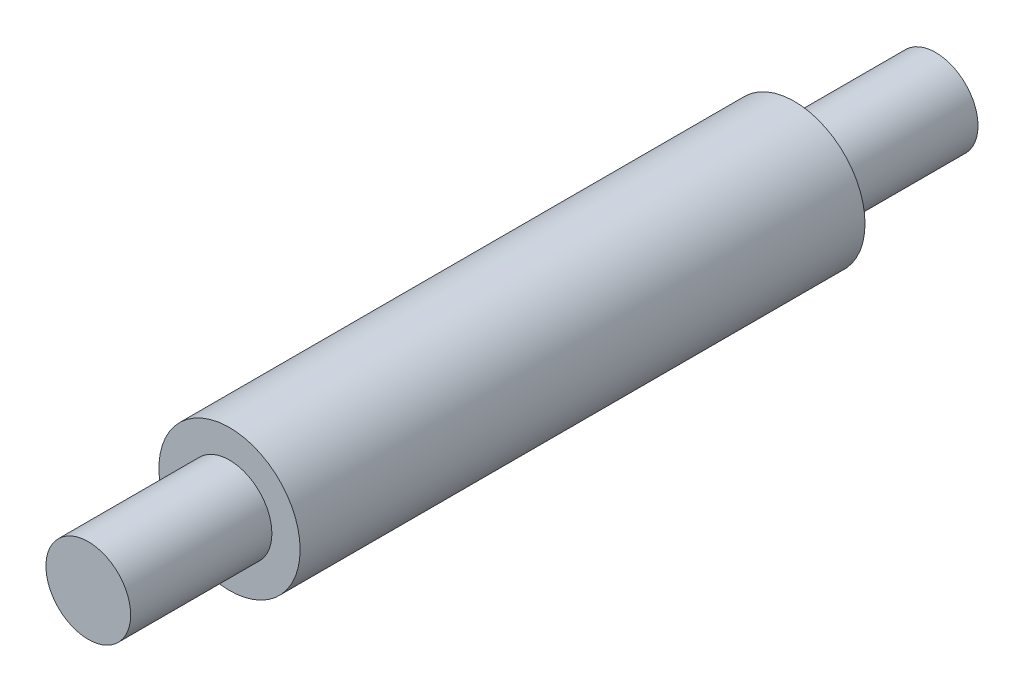
from build123d import *

# Parameters (mm, degrees)
BOSS_EXTRUDE1_DEPTH      = 20
BOSS_EXTRUDE1_DEPTH_BACK = 20
SKETCH1_R                = 5
SKETCH2_R                = 3
BOSS_EXTRUDE2_DEPTH      = 10


with BuildPart() as part:
    # Sketch1 → Boss-Extrude1 (new, two sides: drawn at the far end of the back side and taken through both)
    with BuildSketch(Plane.XY.offset(-BOSS_EXTRUDE1_DEPTH_BACK)):
        Circle(SKETCH1_R)
    extrude(amount=BOSS_EXTRUDE1_DEPTH + BOSS_EXTRUDE1_DEPTH_BACK)

    # Sketch2 → Boss-Extrude2 (add)
    with BuildSketch(Plane.XY.offset(20)):
        Circle(SKETCH2_R)
    boss_extrude2 = extrude(amount=BOSS_EXTRUDE2_DEPTH)

    # Mirror1: Boss-Extrude2 across plane
    add(boss_extrude2.mirror(Plane.XY))


solid = part.part
